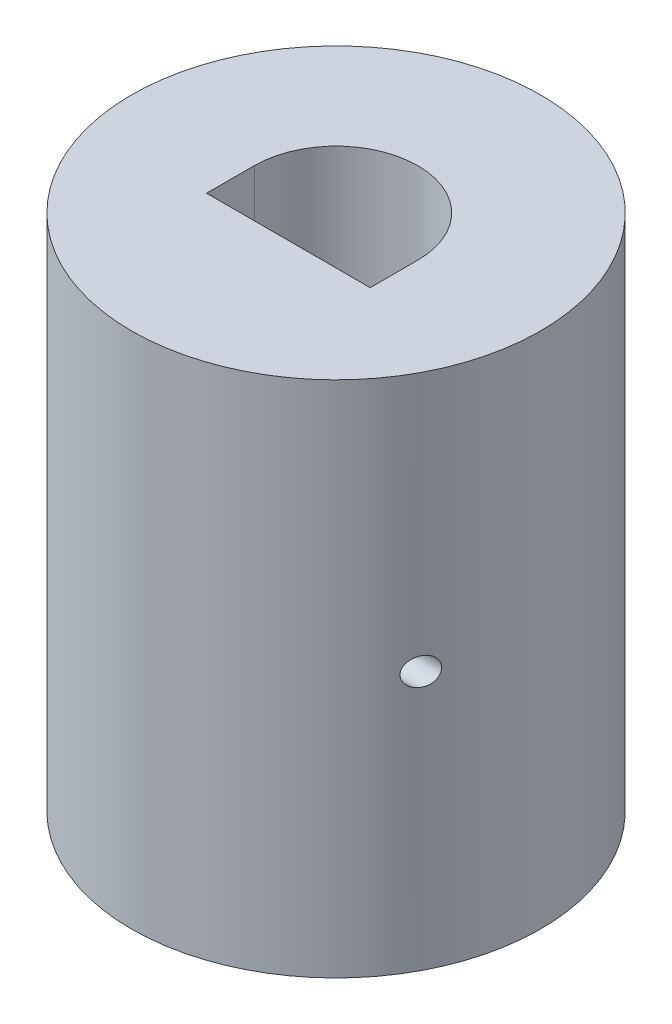
from build123d import *

# Parameters (mm, degrees)
SKETCH1_R               = 7.5
BOSS_EXTRUDE1_DEPTH     = 19
CUT_EXTRUDE1_DEPTH      = 22.760055147
CUT_EXTRUDE2_DEPTH      = 22.760055147
CUT_EXTRUDE2_DEPTH_BACK = 22.760055147
SKETCH3_R               = 0.5


with BuildPart() as part:
    # Sketch1 → Boss-Extrude1 (new body)
    with BuildSketch(Plane(origin=(0, 0, 0), x_dir=(1, 0, 0), z_dir=(0, 1, 0))):
        Circle(SKETCH1_R)
    extrude(amount=BOSS_EXTRUDE1_DEPTH)

    # Sketch2 → Cut-Extrude1 (cut, through all)
    with BuildSketch(Plane.XZ):
        with BuildLine():
            Line((2.436698586, 1.75), (-2.436698586, 1.75))
            Line((-2.436698586, 1.75), (-3, 1.75))
            Line((-3, 1.75), (-3, 0))
            ThreePointArc((-3, 0), (0, -3), (3, 0))
            Line((3, 0), (3, 1.75))
            Line((3, 1.75), (2.436698586, 1.75))
        make_face()
    extrude(amount=-CUT_EXTRUDE1_DEPTH, mode=Mode.SUBTRACT)

    # Sketch3 → Cut-Extrude2 (cut, two sides: drawn at the far end of the back side and taken through both)
    with BuildSketch(Plane(origin=(0, 0, 0), x_dir=(0, 0, -1), z_dir=(1, 0, 0)).offset(-CUT_EXTRUDE2_DEPTH_BACK)):
        with Locations((-3.5, 9.5)):
            Circle(SKETCH3_R)
    extrude(amount=CUT_EXTRUDE2_DEPTH + CUT_EXTRUDE2_DEPTH_BACK, mode=Mode.SUBTRACT)


solid = part.part
